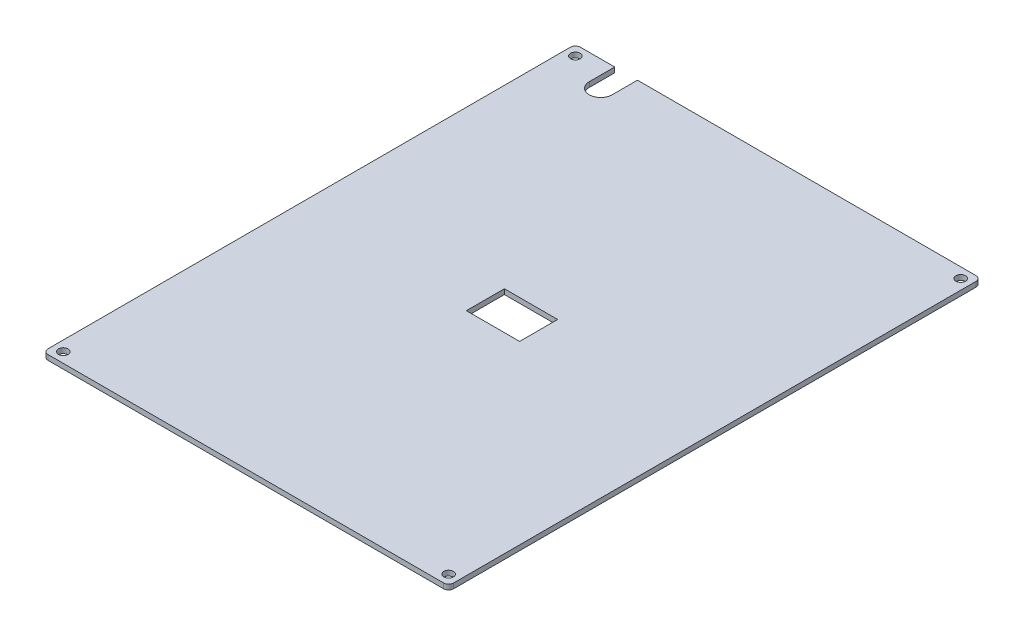
from build123d import *

# Parameters (mm, degrees)
SKETCH1_W           = 160
SKETCH1_H           = 210
BOSS_EXTRUDE1_DEPTH = 2
SKETCH2_R           = 1.9
CUT_EXTRUDE1_DEPTH  = 10
FILLET1_R           = 2
SKETCH3_W           = 21
SKETCH3_H           = 15
CUT_EXTRUDE2_DEPTH  = 10


with BuildPart() as part:
    # Sketch1 → Boss-Extrude1 (new body)
    with BuildSketch(Plane(origin=(0, 0, 0), x_dir=(1, 0, 0), z_dir=(0, 1, 0))):
        with Locations((80, 105)):
            Rectangle(SKETCH1_W, SKETCH1_H)
    extrude(amount=BOSS_EXTRUDE1_DEPTH)

    # Sketch2 → Cut-Extrude1 (cut)
    with BuildSketch(Plane(origin=(0, 2, 0), x_dir=(1, 0, 0), z_dir=(0, 1, 0))):
        with Locations((4, 206)):
            Circle(SKETCH2_R)
        with Locations((156, 206)):
            Circle(SKETCH2_R)
        with Locations((156, 4)):
            Circle(SKETCH2_R)
        with Locations((4, 4)):
            Circle(SKETCH2_R)
        with BuildLine():
            Line((24.5, 200), (24.5, 210))
            Line((24.5, 210), (15.5, 210))
            Line((15.5, 210), (15.5, 200))
            ThreePointArc((15.5, 200), (20, 195.5), (24.5, 200))
        make_face()
    extrude(amount=-CUT_EXTRUDE1_DEPTH, mode=Mode.SUBTRACT)

    # Fillet1
    fillet1_edges = [part.edges().sort_by_distance(p)[0] for p in [
        (0, 1, 0),
        (160, 1, 0),
        (160, 1, -210),
        (0, 1, -210),
    ]]
    fillet(fillet1_edges, radius=FILLET1_R)

    # Sketch3 → Cut-Extrude2 (cut)
    with BuildSketch(Plane(origin=(0, 2, 0), x_dir=(1, 0, 0), z_dir=(0, 1, 0))):
        with Locations((80, 105)):
            Rectangle(SKETCH3_W, SKETCH3_H)
    extrude(amount=-CUT_EXTRUDE2_DEPTH, mode=Mode.SUBTRACT)


solid = part.part
